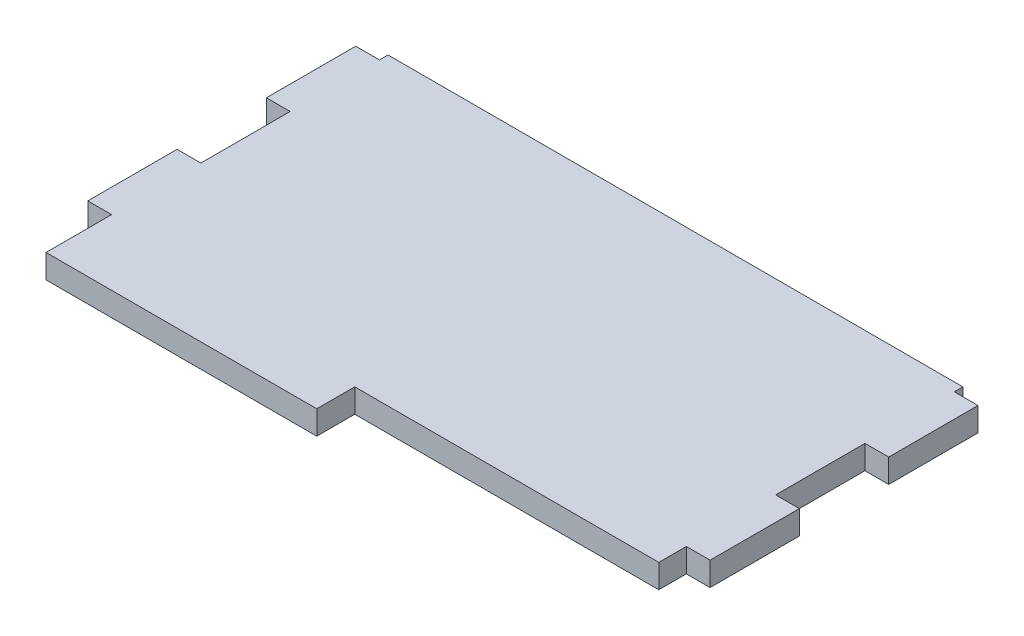
from build123d import *

# Parameters (mm, degrees)
SKETCH1_W           = 83.185
SKETCH1_H           = 59.69
BOSS_EXTRUDE1_DEPTH = 3.175
SKETCH2_W           = 16.637
SKETCH2_H           = 3.175
CUT_EXTRUDE1_DEPTH  = 3.175
LPATTERN1_COUNT     = 3
LPATTERN1_PITCH     = 33.274
SKETCH3_W           = 3.175
SKETCH3_H           = 11.938
CUT_EXTRUDE2_DEPTH  = 3.175
LPATTERN4_COUNT     = 3
LPATTERN4_PITCH     = 23.876
SKETCH4_W           = 16.637
SKETCH4_H           = 3.175
CUT_EXTRUDE4_DEPTH  = 3.175


with BuildPart() as part:
    # Sketch1 → Boss-Extrude1 (new body)
    with BuildSketch(Plane(origin=(0, 0, 0), x_dir=(1, 0, 0), z_dir=(0, 1, 0))):
        Rectangle(SKETCH1_W, SKETCH1_H)
    extrude(amount=BOSS_EXTRUDE1_DEPTH)

    # Sketch2 → Cut-Extrude1 (cut)
    with BuildSketch(Plane(origin=(0, 3.175, 0), x_dir=(1, 0, 0), z_dir=(0, 1, 0))):
        with Locations((-33.274, 28.2575)):
            Rectangle(SKETCH2_W, SKETCH2_H)
        with Locations((-33.274, -28.2575)):
            Rectangle(SKETCH2_W, SKETCH2_H)
    cut_extrude1 = extrude(amount=-CUT_EXTRUDE1_DEPTH, mode=Mode.SUBTRACT)

    # LPattern1: Cut-Extrude1 ×3
    with Locations(*[(i * LPATTERN1_PITCH, 0, 0) for i in range(1, LPATTERN1_COUNT)]):
        add(cut_extrude1, mode=Mode.SUBTRACT)

    # Sketch3 → Cut-Extrude2 (cut)
    with BuildSketch(Plane(origin=(0, 3.175, 0), x_dir=(1, 0, 0), z_dir=(0, 1, 0))):
        with Locations((-40.005, 23.876)):
            Rectangle(SKETCH3_W, SKETCH3_H)
        with Locations((40.005, 23.876)):
            Rectangle(SKETCH3_W, SKETCH3_H)
    cut_extrude2 = extrude(amount=-CUT_EXTRUDE2_DEPTH, mode=Mode.SUBTRACT)

    # LPattern4: Cut-Extrude2 ×3
    with Locations(*[(0, 0, i * LPATTERN4_PITCH) for i in range(1, LPATTERN4_COUNT)]):
        add(cut_extrude2, mode=Mode.SUBTRACT)

    # Sketch4 → Cut-Extrude4 (cut)
    with BuildSketch(Plane(origin=(0, 3.175, 0), x_dir=(1, 0, 0), z_dir=(0, 1, 0))):
        Polygon((-24.9555, 29.845), (-24.9555, 26.67), (-38.4175, 26.67), (-38.4175, 19.05), (38.4175, 19.05), (38.4175, 26.67), (24.9555, 26.67), (24.9555, 29.845), (8.3185, 29.845), (8.3185, 26.67), (-8.3185, 26.67), (-8.3185, 29.845), align=None)
        with Locations((-16.637, -28.2575)):
            Rectangle(SKETCH4_W, SKETCH4_H)
        Polygon((-2.2225, -21.59), (-2.2225, -26.67), (8.3185, -26.67), (8.3185, -29.845), (24.9555, -29.845), (24.9555, -26.67), (38.4175, -26.67), (38.4175, -21.59), align=None)
    extrude(amount=-CUT_EXTRUDE4_DEPTH, mode=Mode.SUBTRACT)


solid = part.part
